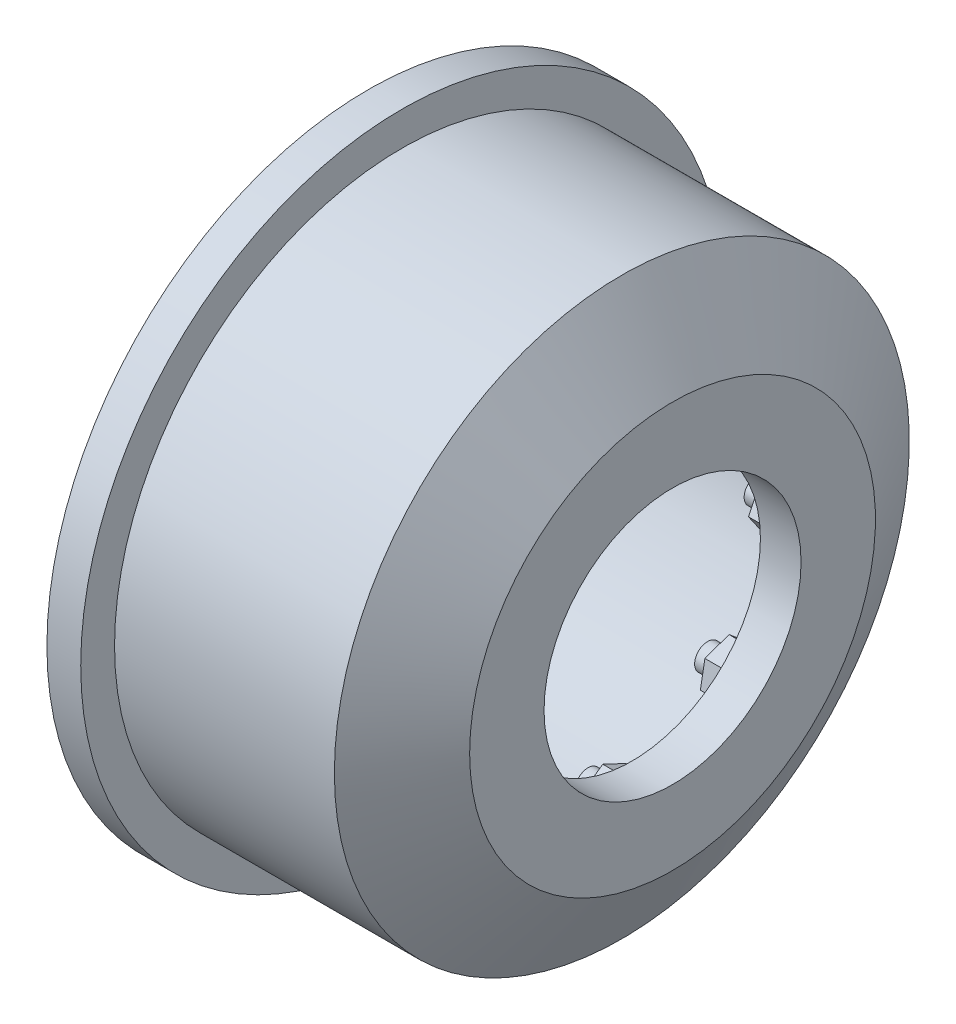
from build123d import *

# Parameters (mm, degrees)
BOSS_EXTRUDE2_DEPTH = 4
SKETCH12_R          = 0.766614543
BOSS_EXTRUDE3_DEPTH = 1


with BuildPart() as part:
    # Sketch1 → Revolve1 (revolve)
    with BuildSketch(Plane(origin=(0, 0, 0), x_dir=(1, 0, 0), z_dir=(0, 1, 0))):
        Polygon((10.139813159, 7.6), (10.139813159, 12), (7.139813159, 17), (-5.860186841, 17), (-5.860186841, 19), (-7.360186841, 19), (-7.860186841, 19), (-7.860186841, 18), (-7.360186841, 18), (-7.360186841, 16.55), (-7.360186841, 14.55), (6.089935015, 14.55), (7.736367227, 11.805946314), (7.736367227, 7.6), align=None)
    revolve(axis=Axis((-37.278866169, 0, 0), (1, 0, 0)))

    # Sketch11 → Boss-Extrude2 (add)
    with BuildSketch(Plane(origin=(10.139813159, 0, 0), x_dir=(0, 0, -1), z_dir=(1, 0, 0))):
        Polygon((7.583227279, 5.645791239), (8.561473265, 6.801972635), (8.049313798, 8.227249208), (6.558908345, 8.496344385), (5.580662358, 7.340162989), (6.092821826, 5.914886416), align=None)
        Polygon((1.369974162, 9.354328702), (1.244154827, 10.863596778), (-0.125819335, 11.509268076), (-1.369974162, 10.645671298), (-1.244154827, 9.136403222), (0.125819335, 8.490731924), align=None)
        Polygon((9.354328702, -1.369974162), (10.863596778, -1.244154827), (11.509268076, 0.125819335), (10.645671298, 1.369974162), (9.136403222, 1.244154827), (8.490731924, -0.125819335), align=None)
        Polygon((5.645791239, -7.583227279), (6.801972635, -8.561473265), (8.227249208, -8.049313798), (8.496344385, -6.558908345), (7.340162989, -5.580662358), (5.914886416, -6.092821826), align=None)
        Polygon((-1.369974162, -9.354328702), (-1.244154827, -10.863596778), (0.125819335, -11.509268076), (1.369974162, -10.645671298), (1.244154827, -9.136403222), (-0.125819335, -8.490731924), align=None)
        Polygon((-7.583227279, -5.645791239), (-8.561473265, -6.801972635), (-8.049313798, -8.227249208), (-6.558908345, -8.496344385), (-5.580662358, -7.340162989), (-6.092821826, -5.914886416), align=None)
        Polygon((-9.354328702, 1.369974162), (-10.863596778, 1.244154827), (-11.509268076, -0.125819335), (-10.645671298, -1.369974162), (-9.136403222, -1.244154827), (-8.490731924, 0.125819335), align=None)
        Polygon((-5.645791239, 7.583227279), (-6.801972635, 8.561473265), (-8.227249208, 8.049313798), (-8.496344385, 6.558908345), (-7.340162989, 5.580662358), (-5.914886416, 6.092821826), align=None)
    extrude(amount=-BOSS_EXTRUDE2_DEPTH)

    # Sketch12 → Boss-Extrude3 (add)
    with BuildSketch(Plane.ZY.offset(-6.139813159)):
        with Locations((-7.071067812, 7.071067812)):
            Circle(SKETCH12_R)
        with Locations((0, 10)):
            Circle(SKETCH12_R)
        with Locations((7.071067812, 7.071067812)):
            Circle(SKETCH12_R)
        with Locations((10, 0)):
            Circle(SKETCH12_R)
        with Locations((7.071067812, -7.071067812)):
            Circle(SKETCH12_R)
        with Locations((0, -10)):
            Circle(SKETCH12_R)
        with Locations((-7.071067812, -7.071067812)):
            Circle(SKETCH12_R)
        with Locations((-10, 0)):
            Circle(SKETCH12_R)
    extrude(amount=BOSS_EXTRUDE3_DEPTH)


solid = part.part
